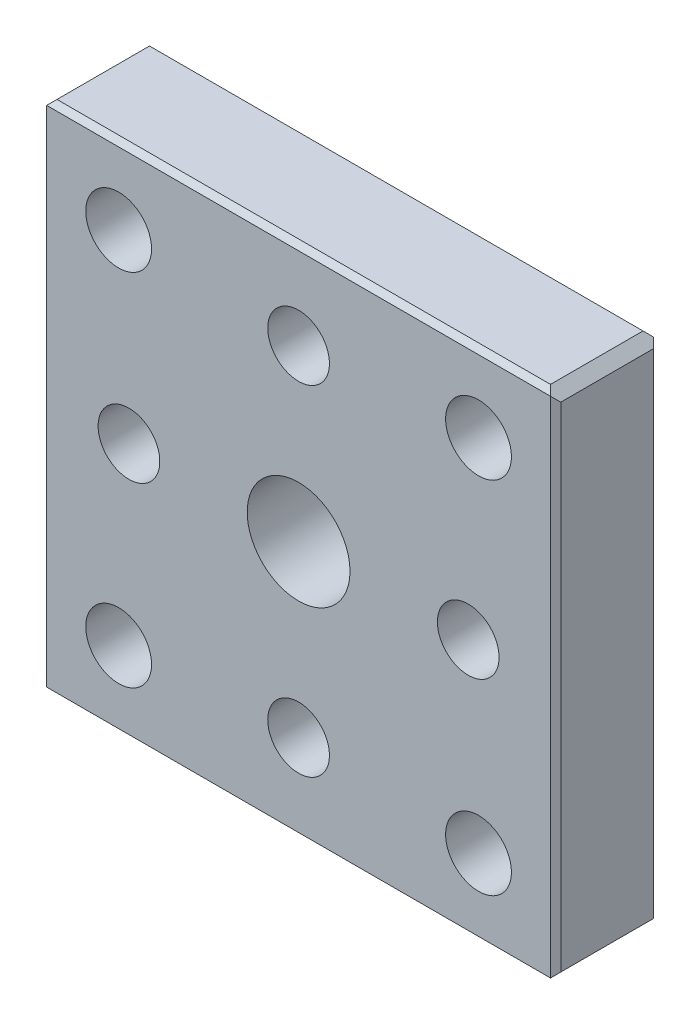
from build123d import *

# Parameters (mm, degrees)
SKETCH1_W                = 50
SKETCH1_H                = 50
BOSS_EXTRUDE1_DEPTH      = 5
M6_CLEARANCE_HOLE1_D     = 6.4
CUT_EXTRUDE1_REACH       = 38.742
SKETCH5_R                = 5
CHAMFER1_SIZE            = 1
CHAMFER2_SIZE            = 0.5
F_6_0_6_DIAMETER_HOLE1_D = 6
SKETCH12_R               = 6.25
CUT_EXTRUDE2_DEPTH       = 3


with BuildPart() as part:
    # Sketch1 → Boss-Extrude1 (new, symmetric)
    with BuildSketch(Plane.XY):
        Rectangle(SKETCH1_W, SKETCH1_H)
    extrude(amount=BOSS_EXTRUDE1_DEPTH, both=True)

    # M6 Clearance Hole1 (through all)
    with Locations(Plane.XY.offset(5)):
        with Locations((-17.5, 17.5), (17.5, 17.5), (17.5, -17.5), (-17.5, -17.5)):
            Hole(M6_CLEARANCE_HOLE1_D / 2)

    # Sketch5 → Cut-Extrude1 (cut, up to next)
    with BuildSketch(Plane.XY.offset(5), mode=Mode.PRIVATE) as cut_extrude1_sk1:
        Circle(SKETCH5_R)
    cut_extrude1_tool1 = extrude(cut_extrude1_sk1.sketch, amount=-CUT_EXTRUDE1_REACH, mode=Mode.PRIVATE) & part.part
    add(cut_extrude1_tool1.solids().sort_by_distance((0, 0, 5))[0], mode=Mode.SUBTRACT)

    # Chamfer1
    chamfer1_edges = [part.edges().sort_by_distance(p)[0] for p in [
        (25, -25, 0),
        (-25, -25, 0),
        (-25, 25, 0),
        (25, 25, 0),
    ]]
    chamfer(chamfer1_edges, length=CHAMFER1_SIZE)

    # Chamfer2
    chamfer2_edges = [part.edges().sort_by_distance(p)[0] for p in [
        (0, -25, 5),
        (0, -25, -5),
        (0, 25, -5),
        (0, 25, 5),
        (25, 0, -5),
        (25, 0, 5),
        (-25, 0, -5),
        (-25, 0, 5),
    ]]
    chamfer(chamfer2_edges, length=CHAMFER2_SIZE - 0.0001)  # a hair under: the kernel refuses the full size

    # Ø6.0 (6) Diameter Hole1 (through all)
    with Locations(Plane(origin=(0, 0, -5), x_dir=(-1, 0, 0), z_dir=(0, 0, -1))):
        with Locations((-16.5, 0), (0, 16.5), (16.5, 0), (0, -16.5)):
            Hole(F_6_0_6_DIAMETER_HOLE1_D / 2)

    # Sketch12 → Cut-Extrude2 (cut)
    with BuildSketch(Plane(origin=(0, 0, -5), x_dir=(-1, 0, 0), z_dir=(0, 0, -1))):
        with Locations((16.5, 0)):
            Circle(SKETCH12_R)
        with Locations((0, -16.5)):
            Circle(SKETCH12_R)
        with Locations((-16.5, 0)):
            Circle(SKETCH12_R)
        with Locations((0, 16.5)):
            Circle(SKETCH12_R)
    extrude(amount=-CUT_EXTRUDE2_DEPTH, mode=Mode.SUBTRACT)


solid = part.part
